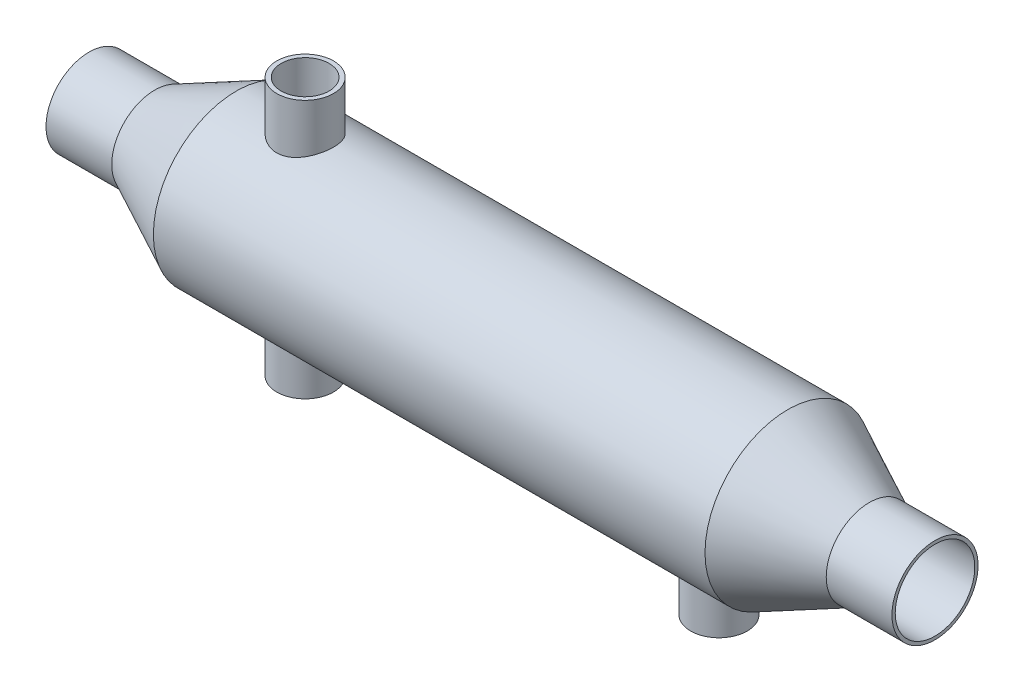
from build123d import *

# Parameters (mm, degrees)
CROQUIS3_W                   = 26
CROQUIS3_H                   = 42.59
CROQUIS8_R                   = 22
CORTAR_EXTRUIR2_DEPTH        = 69
SALIENTE_EXTRUIR4_REACH      = 425.585
SALIENTE_EXTRUIR4_END_RADIUS = 76
CROQUIS7_R                   = 26
CROQUIS7_R_2                 = 22
CROQUIS9_W                   = 26
CROQUIS9_H                   = 42.59
CROQUIS10_W                  = 26
CROQUIS10_H                  = 42.59
CROQUIS11_R                  = 22
CORTAR_EXTRUIR3_DEPTH        = 220
SALIENTE_EXTRUIR5_REACH      = 442.665
SALIENTE_EXTRUIR5_END_RADIUS = 76
CROQUIS12_R                  = 26
CROQUIS12_R_2                = 22
SALIENTE_EXTRUIR6_REACH      = 442.665
SALIENTE_EXTRUIR6_END_RADIUS = 76
CROQUIS13_R                  = 26
CROQUIS13_R_2                = 22


with BuildPart() as part:
    # Croquis2 → Revolución1 (revolve)
    with BuildSketch(Plane(origin=(0, 0, 0), x_dir=(1, 0, 0), z_dir=(0, 1, 0))):
        Polygon((-388, 0), (388, 0), (388, -39.5), (327.69, -39.5), (253, -76), (-253, -76), (-327.69, -39.5), (-388, -39.5), align=None)
    revolve(axis=Axis((-388, 0, 0), (1, 0, 0)))

    # Croquis4 → Cortar-Revolución1 (revolve, cut)
    with BuildSketch(Plane(origin=(0, 0, 0), x_dir=(1, 0, 0), z_dir=(0, 1, 0))):
        Polygon((-388, 0), (388, 0), (388, -36.5), (327, -36.5), (252.305, -73), (-252.305, -73), (-327, -36.5), (-388, -36.5), align=None)
    revolve(axis=Axis((-388, 0, 0), (1, 0, 0)), mode=Mode.SUBTRACT)


with BuildPart() as body_2:
    # Croquis3 → Revolución2 (revolve)
    with BuildSketch(Plane.XY):
        with Locations((202.8, -97.295)):
            Rectangle(CROQUIS3_W, CROQUIS3_H)
    revolve(axis=Axis((189.8, -76, 0), (0, -1, 0)))


with BuildPart() as cortar_extruir2_tool:
    # Croquis8 → Cortar-Extruir2 (new body)
    with BuildSketch(Plane.XZ.offset(118.59)):
        with Locations((189.8, 0)):
            Circle(CROQUIS8_R)
    extrude(amount=-CORTAR_EXTRUIR2_DEPTH)


with BuildPart() as part_1:
    add(part.part)

    # Cortar-Extruir2: cut by cortar_extruir2_tool
    add(cortar_extruir2_tool.part, mode=Mode.SUBTRACT)



with BuildPart() as body_2_1:
    add(body_2.part)

    # Cortar-Extruir2: cut by cortar_extruir2_tool
    add(cortar_extruir2_tool.part, mode=Mode.SUBTRACT)


with BuildPart() as part_2:
    add(part_1.part)

    add(body_2_1.part)  # Saliente-Extruir4 merges body 2
    # Saliente-Extruir4: up to this cylinder (the profile starts outside it)
    saliente_extruir4_end = Plane(origin=(164.535391, 0, 0), z_dir=(-1, 0, 0)) * Cylinder(SALIENTE_EXTRUIR4_END_RADIUS, 1004.17, mode=Mode.PRIVATE)
    # Croquis7 → Saliente-Extruir4 (add, up to the surface)
    with BuildSketch(Plane(origin=(0, -76, 0), x_dir=(1, 0, 0), z_dir=(0, 1, 0)), mode=Mode.PRIVATE) as saliente_extruir4_sk1:
        with Locations((189.8, 0)):
            Circle(CROQUIS7_R)
        with Locations((189.8, 0)):
            Circle(CROQUIS7_R_2, mode=Mode.SUBTRACT)
    saliente_extruir4_tool1 = extrude(saliente_extruir4_sk1.sketch, amount=SALIENTE_EXTRUIR4_REACH, mode=Mode.PRIVATE) - saliente_extruir4_end
    add(saliente_extruir4_tool1.solids().sort_by_distance((164.535391, -76, 0))[0])
    add(saliente_extruir4_tool1.solids().sort_by_distance((164.535391, -76, 0))[1])


with BuildPart() as body_2_2:
    # Croquis9 → Revolución3 (revolve)
    with BuildSketch(Plane.XY):
        with Locations((-176.8, 97.295)):
            Rectangle(CROQUIS9_W, CROQUIS9_H)
    revolve(axis=Axis((-189.8, 76, 0), (0, 1, 0)))


with BuildPart() as body_3:
    # Croquis10 → Revolución4 (revolve)
    with BuildSketch(Plane.XY):
        with Locations((-176.8, -97.295)):
            Rectangle(CROQUIS10_W, CROQUIS10_H)
    revolve(axis=Axis((-189.8, -76, 0), (0, -1, 0)))


with BuildPart() as cortar_extruir3_tool:
    # Croquis11 → Cortar-Extruir3 (new body)
    with BuildSketch(Plane(origin=(0, 118.59, 0), x_dir=(1, 0, 0), z_dir=(0, 1, 0))):
        with Locations((-189.8, 0)):
            Circle(CROQUIS11_R)
    extrude(amount=-CORTAR_EXTRUIR3_DEPTH)


with BuildPart() as part_3:
    add(part_2.part)

    # Cortar-Extruir3: cut by cortar_extruir3_tool
    add(cortar_extruir3_tool.part, mode=Mode.SUBTRACT)



with BuildPart() as body_2_2_1:
    add(body_2_2.part)

    # Cortar-Extruir3: cut by cortar_extruir3_tool
    add(cortar_extruir3_tool.part, mode=Mode.SUBTRACT)


with BuildPart() as body_3_1:
    add(body_3.part)

    # Cortar-Extruir3: cut by cortar_extruir3_tool
    add(cortar_extruir3_tool.part, mode=Mode.SUBTRACT)


with BuildPart() as part_4:
    add(part_3.part)

    add(body_3_1.part)  # Saliente-Extruir5 merges body 3
    # Saliente-Extruir5: up to this cylinder (the profile starts outside it)
    saliente_extruir5_end = Plane(origin=(-215.064609, 0, 0), z_dir=(-1, 0, 0)) * Cylinder(SALIENTE_EXTRUIR5_END_RADIUS, 1038.33, mode=Mode.PRIVATE)
    # Croquis12 → Saliente-Extruir5 (add, up to the surface)
    with BuildSketch(Plane(origin=(0, -76, 0), x_dir=(1, 0, 0), z_dir=(0, 1, 0)), mode=Mode.PRIVATE) as saliente_extruir5_sk1:
        with Locations((-189.8, 0)):
            Circle(CROQUIS12_R)
        with Locations((-189.8, 0)):
            Circle(CROQUIS12_R_2, mode=Mode.SUBTRACT)
    saliente_extruir5_tool1 = extrude(saliente_extruir5_sk1.sketch, amount=SALIENTE_EXTRUIR5_REACH, mode=Mode.PRIVATE) - saliente_extruir5_end
    add(saliente_extruir5_tool1.solids().sort_by_distance((-215.064609, -76, 0))[0])
    add(saliente_extruir5_tool1.solids().sort_by_distance((-215.064609, -76, 0))[1])


    add(body_2_2_1.part)  # Saliente-Extruir6 merges body 2 2
    # Saliente-Extruir6: up to this cylinder (the profile starts outside it)
    saliente_extruir6_end = Plane(origin=(-215.064609, 0, 0), z_dir=(-1, 0, 0)) * Cylinder(SALIENTE_EXTRUIR6_END_RADIUS, 1038.33, mode=Mode.PRIVATE)
    # Croquis13 → Saliente-Extruir6 (add, up to the surface)
    with BuildSketch(Plane.XZ.offset(-76), mode=Mode.PRIVATE) as saliente_extruir6_sk1:
        with Locations((-189.8, 0)):
            Circle(CROQUIS13_R)
        with Locations((-189.8, 0)):
            Circle(CROQUIS13_R_2, mode=Mode.SUBTRACT)
    saliente_extruir6_tool1 = extrude(saliente_extruir6_sk1.sketch, amount=SALIENTE_EXTRUIR6_REACH, mode=Mode.PRIVATE) - saliente_extruir6_end
    add(saliente_extruir6_tool1.solids().sort_by_distance((-215.064609, 76, 0))[0])
    add(saliente_extruir6_tool1.solids().sort_by_distance((-215.064609, 76, 0))[1])


solid = part_4.part
